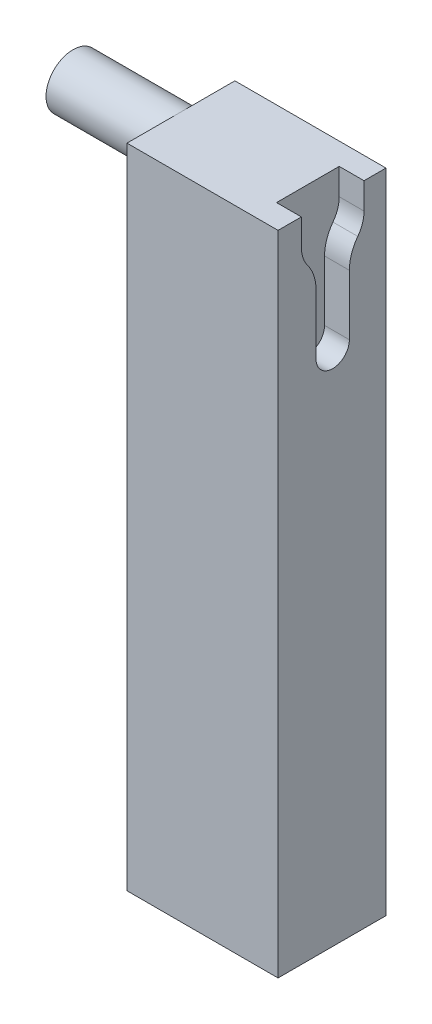
from build123d import *

# Parameters (mm, degrees)
SKETCH1_W           = 35.56
SKETCH1_H           = 25.4
BOSS_EXTRUDE1_DEPTH = 25.4
SKETCH2_R           = 6.35
BOSS_EXTRUDE2_DEPTH = 25.4
CUT_EXTRUDE1_DEPTH  = 5.842
SKETCH7_W           = 35.56
SKETCH7_H           = 25.4
BOSS_EXTRUDE3_DEPTH = 101.6


with BuildPart() as part:
    # Sketch1 → Boss-Extrude1 (new, symmetric)
    with BuildSketch(Plane(origin=(0, 0, 0), x_dir=(1, 0, 0), z_dir=(0, 1, 0))):
        Rectangle(SKETCH1_W, SKETCH1_H)
    extrude(amount=BOSS_EXTRUDE1_DEPTH, both=True)

    # Sketch2 → Boss-Extrude2 (add, symmetric)
    with BuildSketch(Plane.ZY.offset(17.78)):
        with Locations((0, 19.05)):
            Circle(SKETCH2_R)
    extrude(amount=BOSS_EXTRUDE2_DEPTH, both=True)

    # Sketch4 → Cut-Extrude1 (cut)
    with BuildSketch(Plane(origin=(17.78, 0, 0), x_dir=(0, 0, -1), z_dir=(1, 0, 0))):
        with BuildLine():
            ThreePointArc((-5.7416, 14.7838), (-4.273649798, 11.982116734), (-3.767, 8.86))
            Line((-3.767, 8.86), (-3.767, -5.29))
            ThreePointArc((-3.767, -5.29), (0.16, -9.217), (4.087, -5.29))
            Line((4.087, -5.29), (4.087, 8.86))
            ThreePointArc((4.087, 8.86), (4.593649798, 11.982116734), (6.0616, 14.7838))
            ThreePointArc((6.0616, 14.7838), (7.15843669, 16.87718777), (7.537, 19.21))
            Line((7.537, 19.21), (7.537, 26.587))
            Line((7.537, 26.587), (-7.217, 26.587))
            Line((-7.217, 26.587), (-7.217, 19.21))
            ThreePointArc((-7.217, 19.21), (-6.83843669, 16.87718777), (-5.7416, 14.7838))
        make_face()
    extrude(amount=-CUT_EXTRUDE1_DEPTH, mode=Mode.SUBTRACT)

    # Sketch7 → Boss-Extrude3 (add)
    with BuildSketch(Plane.XZ.offset(25.4)):
        Rectangle(SKETCH7_W, SKETCH7_H)
    extrude(amount=BOSS_EXTRUDE3_DEPTH)


solid = part.part
